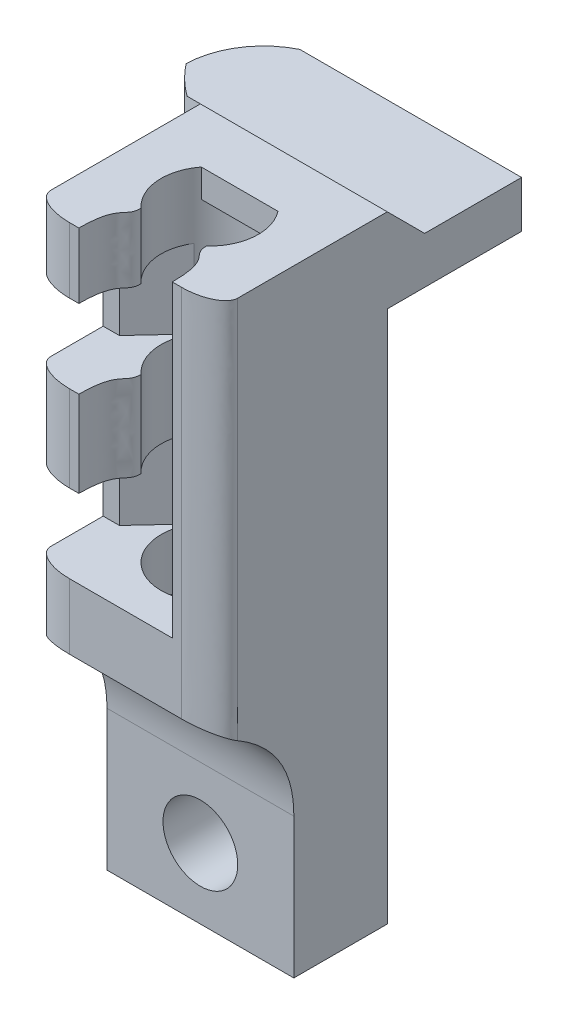
from build123d import *

# Parameters (mm, degrees)
BOSS_EXTRUDE1_DEPTH             = 5
CUT_EXTRUDE1_REACH              = 19.493
SKETCH2_R                       = 2
BOSS_EXTRUDE2_DEPTH             = 5
CUT_EXTRUDE4_DEPTH              = 17.5
CUT_EXTRUDE10_START             = 17.5
CUT_EXTRUDE10_DEPTH             = 16
SKETCH15_W                      = 3.25
SKETCH15_H                      = 4.2
CUT_EXTRUDE11_DEPTH             = 3.8
CHAMFER2_START                  = 1.5
CHAMFER2_DEPTH                  = 4.2
CHAMFER2_START_2                = 10.3
CHAMFER2_2_DEPTH                = 4.2
CUT_EXTRUDE7_START              = -15
CUT_EXTRUDE7_DEPTH              = 28.5
BOSS_EXTRUDE7_DEPTH             = 2.5
BOSS_EXTRUDE8_DEPTH             = 2
BOSS_EXTRUDE8_DIRECTION_2_REACH = 33.286
SKETCH17_W                      = 10
SKETCH17_H                      = 9
BOSS_EXTRUDE10_DEPTH            = 2
CUT_EXTRUDE12_START             = 18
CUT_EXTRUDE12_DEPTH             = 2
CUT_EXTRUDE13_START             = 2
CUT_EXTRUDE13_DEPTH             = 2
CUT_EXTRUDE14_START             = 0.5
CUT_EXTRUDE14_DEPTH             = 0.5
FILLET8_SIZE                    = 2
FILLET8_SIZE_2                  = 1
FILLET6_SIZE                    = 1
FILLET6_SIZE_2                  = 2
CHAMFER3_SIZE                   = 2


with BuildPart() as part:
    # Sketch1 → Boss-Extrude1 (new, symmetric)
    with BuildSketch(Plane(origin=(0, 0, 0), x_dir=(0, 0, -1), z_dir=(1, 0, 0))):
        with BuildLine():
            Line((-5, -15), (-5, -7.5))
            add(Edge.make_bspline(
                [(-5, -7.5), (-4.98696359, -3.758210307), (-9, -2)],
                knots=[0, 0, 0, 1, 1, 1], degree=2))
            Line((-9, -2), (-9, 16))
            Line((-9, 16), (0, 16))
            Line((0, 16), (0, 0))
            Line((0, 0), (0, -15))
            Line((0, -15), (-5, -15))
        make_face()
    extrude(amount=BOSS_EXTRUDE1_DEPTH, both=True)

    # Sketch2 → Cut-Extrude1 (cut, up to next)
    with BuildSketch(Plane.XY.offset(5), mode=Mode.PRIVATE) as cut_extrude1_sk1:
        with Locations((0, -11.25)):
            Circle(SKETCH2_R)
    cut_extrude1_tool1 = extrude(cut_extrude1_sk1.sketch, amount=-CUT_EXTRUDE1_REACH, mode=Mode.PRIVATE) & part.part
    add(cut_extrude1_tool1.solids().sort_by_distance((0, -11.25, 5))[0], mode=Mode.SUBTRACT)

    # Sketch5 → Boss-Extrude2 (add, symmetric)
    with BuildSketch(Plane(origin=(0, 0, 0), x_dir=(0, 0, -1), z_dir=(1, 0, 0))):
        with BuildLine():
            Line((1.5, 13.5), (0, 13.5))
            Line((0, 13.5), (0, 16))
            add(Edge.make_bspline(
                [(1.5, 13.5), (1.5, 15.23543045), (1.140641964, 16), (0, 16)],
                knots=[0, 0, 0, 0, 1, 1, 1, 1], degree=3))
        make_face()
    extrude(amount=BOSS_EXTRUDE2_DEPTH, both=True)

    # Sketch6 → Cut-Extrude4 (cut)
    with BuildSketch(Plane(origin=(0, 16, 0), x_dir=(1, 0, 0), z_dir=(0, 1, 0))):
        with BuildLine():
            ThreePointArc((2.049390153, -2.9), (0, -1.9), (-2.049390153, -2.9))
            Line((-2.049390153, -2.9), (2.049390153, -2.9))
        make_face()
        with BuildLine():
            Line((2.049390153, -2.9), (-2.049390153, -2.9))
            ThreePointArc((-2.049390153, -2.9), (-0.846045389, -6.958496939), (2.6, -4.5))
            ThreePointArc((2.6, -4.5), (2.458496939, -3.653954611), (2.049390153, -2.9))
        make_face()
    extrude(amount=-CUT_EXTRUDE4_DEPTH, mode=Mode.SUBTRACT)

    # Sketch13 → Cut-Extrude10 (cut)
    with BuildSketch(Plane(origin=(0, 0, 0), x_dir=(1, 0, 0), z_dir=(0, 1, 0)).offset(CUT_EXTRUDE10_START)):
        with BuildLine():
            ThreePointArc((1.75, -6.422888452), (0, -7.1), (-1.75, -6.422888452))
            add(Edge.make_bspline(
                [(-1.75, -6.422888452), (-1.75, -7.3), (-2.5, -6.8), (-2.5, -9)],
                knots=[0, 0, 0, 0, 1, 1, 1, 1], degree=3))
            Line((-2.5, -9), (2.5, -9))
            add(Edge.make_bspline(
                [(1.75, -6.422888452), (1.75, -7.3), (2.5, -6.8), (2.5, -9)],
                knots=[0, 0, 0, 0, 1, 1, 1, 1], degree=3))
        make_face()
    extrude(amount=-CUT_EXTRUDE10_DEPTH, mode=Mode.SUBTRACT)

    # Sketch15 → Cut-Extrude11 (cut)
    with BuildSketch(Plane.XY.offset(9)):
        with Locations((-3.375, 3.6)):
            Rectangle(SKETCH15_W, SKETCH15_H)
        with Locations((-3.375, 12.4)):
            Rectangle(SKETCH15_W, SKETCH15_H)
    extrude(amount=-CUT_EXTRUDE11_DEPTH, mode=Mode.SUBTRACT)

    # Chamfer2: read off the stored shape, not the designer's step
    # Chamfer2 outline → Chamfer2 (cut)
    with BuildSketch(Plane(origin=(0, 0, 0), x_dir=(1, 0, 0), z_dir=(0, 1, 0)).offset(CHAMFER2_START)):
        with BuildLine():
            ThreePointArc((-2.503996805, -5.2), (-2.574603342, -4.137484302), (-2.213344965, -3.13577712))
            Line((-2.213344965, -3.13577712), (-4.130598027, -5.2))
            Line((-4.130598027, -5.2), (-2.503996805, -5.2))
        make_face()
    extrude(amount=CHAMFER2_DEPTH, mode=Mode.SUBTRACT)

    # Chamfer2 2 outline → Chamfer2 2 (cut)
    with BuildSketch(Plane(origin=(0, 0, 0), x_dir=(1, 0, 0), z_dir=(0, 1, 0)).offset(CHAMFER2_START_2)):
        with BuildLine():
            ThreePointArc((-2.503996805, -5.2), (-2.574603342, -4.137484302), (-2.213344965, -3.13577712))
            Line((-2.213344965, -3.13577712), (-4.130598027, -5.2))
            Line((-4.130598027, -5.2), (-2.503996805, -5.2))
        make_face()
    extrude(amount=CHAMFER2_2_DEPTH, mode=Mode.SUBTRACT)

    # Sketch9 → Cut-Extrude7 (cut)
    with BuildSketch(Plane(origin=(0, 0, 0), x_dir=(1, 0, 0), z_dir=(0, 1, 0)).offset(CUT_EXTRUDE7_START)):
        with BuildLine():
            Line((5, 0), (-5, 0))
            ThreePointArc((-5, 0), (0, -0.138996222), (5, 0))
        make_face()
    extrude(amount=CUT_EXTRUDE7_DEPTH, mode=Mode.SUBTRACT)

    # Sketch12 → Boss-Extrude7 (add)
    with BuildSketch(Plane.XZ.offset(-13.5)):
        with BuildLine():
            Line((5, 0), (-5, 0))
            Line((-5, 0), (-5, -0.75))
            ThreePointArc((-5, -0.75), (-7.356122713, -1.757737527), (-9.249008864, -3.485114493))
            Line((-9.249008864, -3.485114493), (-7.446859958, -3.218783834))
            Line((-7.446859958, -3.218783834), (-6.860693731, -7.185127133))
            Line((-6.860693731, -7.185127133), (5, -7.185127133))
            Line((5, -7.185127133), (5, 0))
        make_face()
    extrude(amount=-BOSS_EXTRUDE7_DEPTH)

    # Sketch12<4> → Boss-Extrude8 (add)
    with BuildSketch(Plane.XZ.offset(-13.5)):
        with BuildLine():
            Line((-9.249008864, -3.485114493), (-7.446859958, -3.218783834))
            Line((-7.446859958, -3.218783834), (-6.860693731, -7.185127133))
            ThreePointArc((-6.860693731, -7.185127133), (-8.565464188, -5.664715496), (-9.249008864, -3.485114493))
        make_face()
    extrude(amount=BOSS_EXTRUDE8_DEPTH)

    # Boss-Extrude8 direction 2: up to this face of the body (flat: up to its plane)
    boss_extrude8_direction_2_end = Plane(part.part.faces().sort_by_distance((-0.643733598, 16, -0.592776419))[0])
    # Sketch12<4> → Boss-Extrude8 direction 2 (add, up to the picked face)
    with BuildSketch(Plane.XZ.offset(-13.5), mode=Mode.PRIVATE) as boss_extrude8_direction_2_sk1:
        with BuildLine():
            Line((-9.249008864, -3.485114493), (-7.446859958, -3.218783834))
            Line((-7.446859958, -3.218783834), (-6.860693731, -7.185127133))
            ThreePointArc((-6.860693731, -7.185127133), (-8.565464188, -5.664715496), (-9.249008864, -3.485114493))
        make_face()
    boss_extrude8_direction_2_tool1 = split(extrude(boss_extrude8_direction_2_sk1.sketch, amount=-BOSS_EXTRUDE8_DIRECTION_2_REACH, mode=Mode.PRIVATE), bisect_by=boss_extrude8_direction_2_end, keep=Keep.BOTH, mode=Mode.PRIVATE)
    add(boss_extrude8_direction_2_tool1.solids().sort_by(Axis((-7.987517, 13.5, -4.907532), (0, 1, 0)))[0])

    # Sketch17 → Boss-Extrude10 (add)
    with BuildSketch(Plane(origin=(0, 16, 0), x_dir=(1, 0, 0), z_dir=(0, 1, 0))):
        with Locations((0, -4.5)):
            Rectangle(SKETCH17_W, SKETCH17_H)
    extrude(amount=BOSS_EXTRUDE10_DEPTH)

    # Sketch13<3> → Cut-Extrude12 (cut)
    with BuildSketch(Plane(origin=(0, 0, 0), x_dir=(1, 0, 0), z_dir=(0, 1, 0)).offset(CUT_EXTRUDE12_START)):
        with BuildLine():
            Line((-2.5, -9), (2.5, -9))
            add(Edge.make_bspline(
                [(1.75, -6.422888452), (1.75, -7.3), (2.5, -6.8), (2.5, -9)],
                knots=[0, 0, 0, 0, 1, 1, 1, 1], degree=3))
            ThreePointArc((1.75, -6.422888452), (0, -7.1), (-1.75, -6.422888452))
            add(Edge.make_bspline(
                [(-1.75, -6.422888452), (-1.75, -7.3), (-2.5, -6.8), (-2.5, -9)],
                knots=[0, 0, 0, 0, 1, 1, 1, 1], degree=3))
        make_face()
    extrude(amount=-CUT_EXTRUDE12_DEPTH, mode=Mode.SUBTRACT)

    # Sketch6<4> → Cut-Extrude13 (cut)
    with BuildSketch(Plane(origin=(0, 16, 0), x_dir=(1, 0, 0), z_dir=(0, 1, 0)).offset(CUT_EXTRUDE13_START)):
        with BuildLine():
            Line((2.049390153, -2.9), (-2.049390153, -2.9))
            ThreePointArc((-2.049390153, -2.9), (-0.846045389, -6.958496939), (2.6, -4.5))
            ThreePointArc((2.6, -4.5), (2.458496939, -3.653954611), (2.049390153, -2.9))
        make_face()
    extrude(amount=-CUT_EXTRUDE13_DEPTH, mode=Mode.SUBTRACT)

    # Sketch6<5> → Cut-Extrude14 (cut)
    with BuildSketch(Plane(origin=(0, 16, 0), x_dir=(1, 0, 0), z_dir=(0, 1, 0)).offset(CUT_EXTRUDE14_START)):
        with BuildLine():
            ThreePointArc((2.049390153, -2.9), (0, -1.9), (-2.049390153, -2.9))
            Line((-2.049390153, -2.9), (2.049390153, -2.9))
        make_face()
        with BuildLine():
            Line((2.049390153, -2.9), (-2.049390153, -2.9))
            ThreePointArc((-2.049390153, -2.9), (-0.846045389, -6.958496939), (2.6, -4.5))
            ThreePointArc((2.6, -4.5), (2.458496939, -3.653954611), (2.049390153, -2.9))
        make_face()
    extrude(amount=-CUT_EXTRUDE14_DEPTH, mode=Mode.SUBTRACT)

    # Fillet8
    # a fillet whose section is not a circle: 2, 1 mm, written as the material it takes off along each edge
    with BuildSketch(Plane(origin=(5, 23, 9), x_dir=(-1, 0, 0), z_dir=(0, -1, 0))) as fillet8_piece_1:
        with BuildLine():
            Bezier((FILLET8_SIZE, 0), (0, 0), (0, FILLET8_SIZE_2), weights=[1, 0.707106781, 1])
            Line((0, FILLET8_SIZE_2), (0, 0))
            Line((0, 0), (FILLET8_SIZE, 0))
        make_face()
    extrude(amount=30, mode=Mode.SUBTRACT)

    # Fillet6
    # a fillet whose section is not a circle: 2, 1 mm, written as the material it takes off along each edge
    with BuildSketch(Plane(origin=(-5, -7, 9), x_dir=(0, 0, -1), z_dir=(0, 1, 0)), Plane(origin=(-5, 9.5, 9), x_dir=(0, 0, -1), z_dir=(0, 1, 0))) as fillet6_piece_1:
        with BuildLine():
            Bezier((FILLET6_SIZE, 0), (0, 0), (0, -FILLET6_SIZE_2), weights=[1, 0.707106781, 1])
            Line((0, -FILLET6_SIZE_2), (0, 0))
            Line((0, 0), (FILLET6_SIZE, 0))
        make_face()
    extrude(amount=13.5, mode=Mode.SUBTRACT)
    with BuildSketch(Plane(origin=(-5, 0.7, 9), x_dir=(0, 0, -1), z_dir=(0, 1, 0))) as fillet6_piece_2:
        with BuildLine():
            Bezier((FILLET6_SIZE, 0), (0, 0), (0, -FILLET6_SIZE_2), weights=[1, 0.707106781, 1])
            Line((0, -FILLET6_SIZE_2), (0, 0))
            Line((0, 0), (FILLET6_SIZE, 0))
        make_face()
    extrude(amount=14.6, mode=Mode.SUBTRACT)

    # Chamfer3
    chamfer3_edges = [part.edges().sort_by_distance(p)[0] for p in [
        (0, 16, 0),
    ]]
    chamfer(chamfer3_edges, length=CHAMFER3_SIZE - 0.0001)  # a hair under: the kernel refuses the full size


solid = part.part
